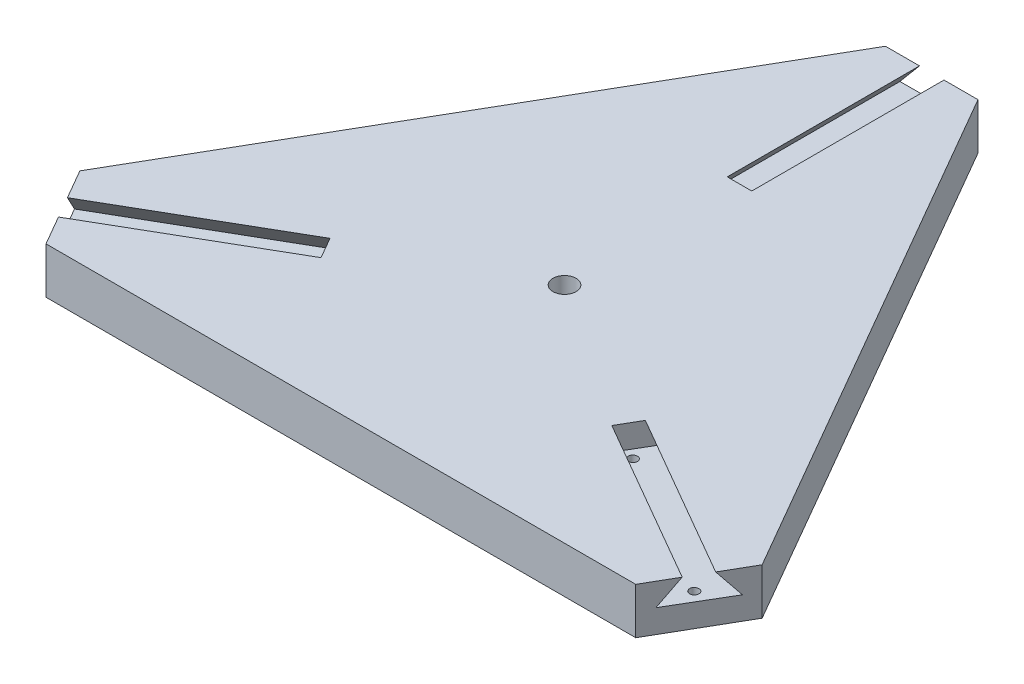
from build123d import *

# Parameters (mm, degrees)
ESQUISSE1_R                  = 2.5
BOSS_EXTRU_1_DEPTH           = 5
ESQUISSE2_R                  = 1
ENL_V_MAT_EXTRU_1_DEPTH      = 109.799753466
R_P_TITION_CIRCULAIRE1_COUNT = 3
ENL_V_MAT_EXTRU_2_DEPTH      = 41.553
R_P_TITION_CIRCULAIRE2_COUNT = 3


with BuildPart() as part:
    # Esquisse1 → Boss.-Extru.1 (new, symmetric)
    with BuildSketch(Plane(origin=(0, 0, 0), x_dir=(1, 0, 0), z_dir=(0, 1, 0))):
        Polygon((-10, 79.372539332), (10, 79.372539332), (73.738635424, -31.026015628), (63.738635424, -48.346523704), (-63.738635424, -48.346523704), (-73.738635424, -31.026015628), align=None)
        Circle(ESQUISSE1_R, mode=Mode.SUBTRACT)
    extrude(amount=BOSS_EXTRU_1_DEPTH, both=True)

    # Esquisse2 → Enlèv. mat.-Extru.1 (cut, through all)
    with BuildSketch(Plane(origin=(0, 5, 0), x_dir=(1, 0, 0), z_dir=(0, 1, 0))):
        with Locations((-66.357065564, -38.311269666)):
            Circle(ESQUISSE2_R)
        with Locations((-34.920343407, -20.161269666)):
            Circle(ESQUISSE2_R)
    enl_v_mat_extru_1 = extrude(amount=-ENL_V_MAT_EXTRU_1_DEPTH, mode=Mode.SUBTRACT)

    # Répétition circulaire1: Enlèv. mat.-Extru.1 ×3 about axis
    r_p_tition_circulaire1_axis = Axis((0, 5, 0), (0, -1, 0))
    for i in range(1, R_P_TITION_CIRCULAIRE1_COUNT):
        add(enl_v_mat_extru_1.rotate(r_p_tition_circulaire1_axis, i * 360 / R_P_TITION_CIRCULAIRE1_COUNT), mode=Mode.SUBTRACT)

    # Esquisse3 → Enlèv. mat.-Extru.2 (cut)
    with BuildSketch(Plane(origin=(68.738635424, 0, 39.686269666), x_dir=(0.5000000000000043, 0, -0.8660254037844363), z_dir=(0.8660254037844362, 0, 0.5000000000000042))):
        Polygon((2.65, 5), (6.882765547, -0.044413547), (-6.807234453, 0.045600905), (-2.65, 5), align=None)
    enl_v_mat_extru_2 = extrude(amount=-ENL_V_MAT_EXTRU_2_DEPTH, mode=Mode.SUBTRACT)

    # Répétition circulaire2: Enlèv. mat.-Extru.2 ×3 about axis
    r_p_tition_circulaire2_axis = Axis((0, 5, 0), (0, -1, 0))
    for i in range(1, R_P_TITION_CIRCULAIRE2_COUNT):
        add(enl_v_mat_extru_2.rotate(r_p_tition_circulaire2_axis, i * 360 / R_P_TITION_CIRCULAIRE2_COUNT), mode=Mode.SUBTRACT)


solid = part.part
